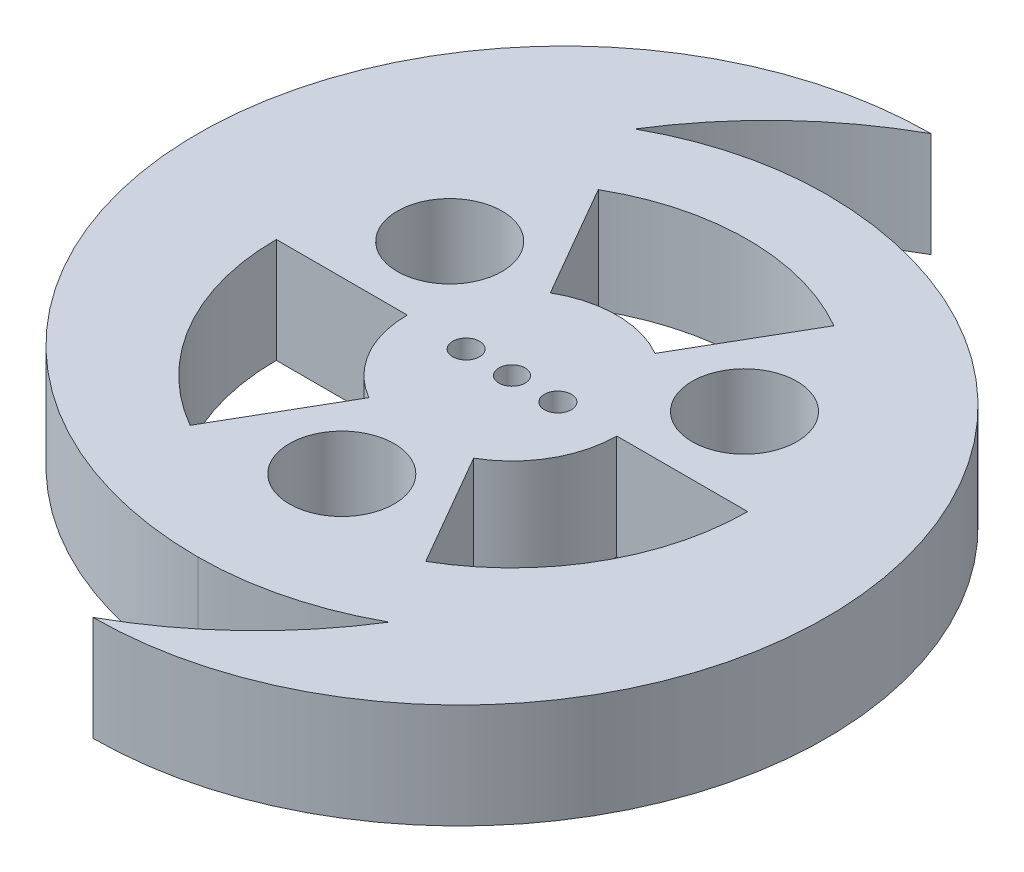
from build123d import *

# Parameters (mm, degrees)
SKETCH1_R             = 1.595
BOSS_EXTRUDE1_DEPTH   = 12.7
SKETCH2_R             = 6.35
CUT_EXTRUDE1_DEPTH    = 69.685751798
F_4_CLEARANCE_HOLE1_D = 3.2639


with BuildPart() as part:
    # Sketch1 → Boss-Extrude1 (new body)
    with BuildSketch(Plane(origin=(0, 0, 0), x_dir=(1, 0, 0), z_dir=(0, 1, 0))):
        with BuildLine():
            ThreePointArc((18.445083186, -33.3375), (10.331555752, -43.240166373), (0, -50.8))
            ThreePointArc((0, -50.8), (44.45, -6.35), (0, 38.1))
            ThreePointArc((0, 38.1), (-9.525, 36.890166373), (-18.445083186, 33.3375))
            ThreePointArc((-18.445083186, 33.3375), (-10.331555752, 43.240166373), (0, 50.8))
            ThreePointArc((0, 50.8), (-44.45, 6.35), (0, -38.1))
            ThreePointArc((0, -38.1), (9.525, -36.890166373), (18.445083186, -33.3375))
        make_face()
        Circle(SKETCH1_R, mode=Mode.SUBTRACT)
    extrude(amount=BOSS_EXTRUDE1_DEPTH)

    # Sketch2 → Cut-Extrude1 (cut, through all)
    with BuildSketch(Plane(origin=(0, 12.7, 0), x_dir=(1, 0, 0), z_dir=(0, 1, 0))):
        with BuildLine():
            Line((-12.7, 0), (-28.575, 0))
            ThreePointArc((-28.575, 0), (-24.746675913, -14.2875), (-14.2875, -24.746675913))
            Line((-14.2875, -24.746675913), (-6.35, -10.998522628))
            ThreePointArc((-6.35, -10.998522628), (-10.998522628, -6.35), (-12.7, 0))
        make_face()
        with BuildLine():
            Line((28.575, 0), (12.7, 0))
            ThreePointArc((12.7, 0), (10.998522628, -6.35), (6.35, -10.998522628))
            Line((6.35, -10.998522628), (14.2875, -24.746675913))
            ThreePointArc((14.2875, -24.746675913), (24.746675913, -14.2875), (28.575, 0))
        make_face()
        with BuildLine():
            Line((-14.2875, 24.746675913), (-6.35, 10.998522628))
            ThreePointArc((-6.35, 10.998522628), (0, 12.7), (6.35, 10.998522628))
            Line((6.35, 10.998522628), (14.2875, 24.746675913))
            ThreePointArc((14.2875, 24.746675913), (0, 28.575), (-14.2875, 24.746675913))
        make_face()
        with Locations((0, -20.6375)):
            Circle(SKETCH2_R)
        with Locations((-17.872599271, 10.31875)):
            Circle(SKETCH2_R)
        with Locations((17.872599271, 10.31875)):
            Circle(SKETCH2_R)
    extrude(amount=-CUT_EXTRUDE1_DEPTH, mode=Mode.SUBTRACT)

    # #4 Clearance Hole1 (through all)
    with Locations(Plane(origin=(0, 12.7, 0), x_dir=(1, 0, 0), z_dir=(0, 1, 0))):
        with Locations((-5.5626, 0), (5.5626, 0)):
            Hole(F_4_CLEARANCE_HOLE1_D / 2)


solid = part.part
